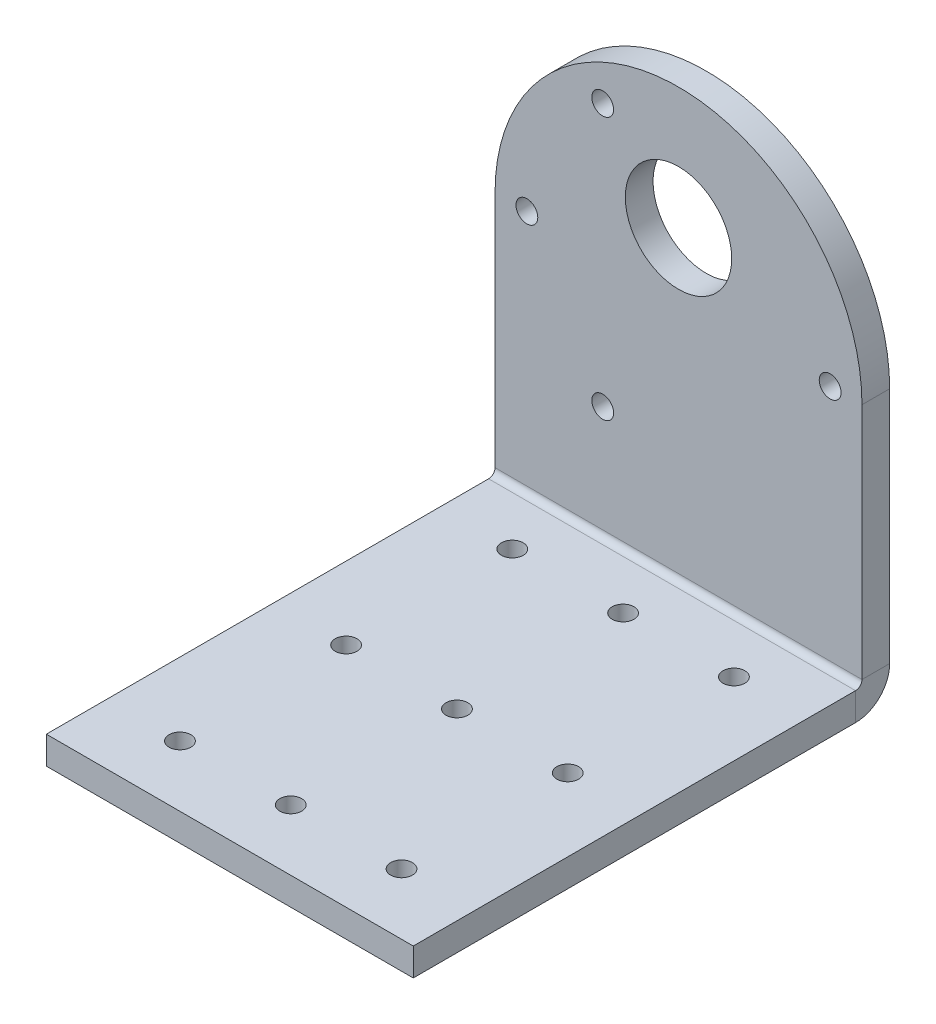
from build123d import *

# Parameters (mm, degrees)
BASE_FLANGIA1_DEPTH            = 3.175
BORDO_FLANGIA1_STRIP_W         = 14.1732
BORDO_FLANGIA1_STRIP_H         = 3.175
BORDO_FLANGIA1_STRIP_CUT_DEPTH = 42.0624
BORDO_FLANGIA1_DEPTH           = 42.0624
RIPETIZIONE_A_L1_COUNT         = 3
RIPETIZIONE_A_L1_PITCH         = 19.05
RIPETIZIONE_A_L1_COUNT_DIR2    = 3
RIPETIZIONE_A_L1_PITCH_DIR2    = 12.7
RIPETIZIONECIRCOLARE1_COUNT    = 6
SCHIZZO13_R                    = 6.096
TAGLIO_ESTRUSIONE1_DEPTH       = 10


# Sheet-metal steps are written as plain solids
with BuildPart() as part:
    # Schizzo1 → Base-Flangia1 (new body)
    with BuildSketch(Plane.XY):
        with BuildLine():
            Line((-21.0312, 0), (21.0312, 0))
            Line((21.0312, 0), (21.0312, 31.1912))
            ThreePointArc((21.0312, 31.1912), (0, 52.2224), (-21.0312, 31.1912))
            Line((-21.0312, 31.1912), (-21.0312, 0))
        make_face()
    extrude(amount=-BASE_FLANGIA1_DEPTH)

    # Bordo-Flangia1 strip (across the edge) → Bordo-Flangia1 strip cut (cut)
    with BuildSketch(Plane.YZ.offset(-21.0312)):
        with Locations((-3.175, -1.5875)):
            Rectangle(BORDO_FLANGIA1_STRIP_W, BORDO_FLANGIA1_STRIP_H)
    extrude(amount=BORDO_FLANGIA1_STRIP_CUT_DEPTH, mode=Mode.SUBTRACT)

    # Bordo-Flangia1 section (across the edge) → Bordo-Flangia1 (add)
    with BuildSketch(Plane.YZ.offset(-21.0312)):
        with BuildLine():
            Line((0, 0.7366), (0, 51.435))
            Line((0, 51.435), (3.175, 51.435))
            Line((3.175, 51.435), (3.175, 0.7366))
            ThreePointArc((3.175, 0.7366), (3.390745145, 0.215745145), (3.9116, 0))
            Line((3.9116, 0), (3.9116, -3.175))
            ThreePointArc((3.9116, -3.175), (1.145681115, -2.029318885), (0, 0.7366))
        make_face()
    extrude(amount=BORDO_FLANGIA1_DEPTH)

    # Schizzo9 → Foro filettato M3x0.5-1 (revolve, cut)
    with BuildSketch(Plane(origin=(-12.7, 3.175, 6.35), x_dir=(0, 0, 1), z_dir=(1, 0, 0))):
        Polygon((0, 0), (0, 8.251075774), (1.25, 7.5), (1.25, 0), align=None)
    foro_filettato_m3x0_5_1 = revolve(axis=Axis((-12.7, 9.525, 6.35), (0, -1, 0)), mode=Mode.SUBTRACT)

    # Ripetizione a L1: Foro filettato M3x0.5-1 3 × 3
    with Locations(*[(j * RIPETIZIONE_A_L1_PITCH_DIR2, 0, i * RIPETIZIONE_A_L1_PITCH) for i in range(RIPETIZIONE_A_L1_COUNT) for j in range(RIPETIZIONE_A_L1_COUNT_DIR2) if (i, j) != (0, 0)]):
        add(foro_filettato_m3x0_5_1, mode=Mode.SUBTRACT)

    # Schizzo11 → Foro filettato M3x0.5-2 (revolve, cut)
    with BuildSketch(Plane(origin=(-17.3812, 31.1912, -3.175), x_dir=(0, 1, 0), z_dir=(1, 0, 0))):
        Polygon((0, 0), (0, 8.251075774), (1.25, 7.5), (1.25, 0), align=None)
    foro_filettato_m3x0_5_2 = revolve(axis=Axis((-17.3812, 31.1912, -9.525), (0, 0, 1)), mode=Mode.SUBTRACT)

    # RipetizioneCircolare1: Foro filettato M3x0.5-2 ×6 about axis, 2 skipped
    ripetizionecircolare1_axis = Axis((0, 31.1912, 0), (0, 0, 1))
    add([foro_filettato_m3x0_5_2.rotate(ripetizionecircolare1_axis, i * 360 / RIPETIZIONECIRCOLARE1_COUNT) for i in range(1, RIPETIZIONECIRCOLARE1_COUNT) if i not in (2, 4)], mode=Mode.SUBTRACT)

    # Schizzo13 → Taglio-Estrusione1 (cut)
    with BuildSketch(Plane(origin=(0, 0, -3.175), x_dir=(-1, 0, 0), z_dir=(0, 0, -1))):
        with Locations((0, 38.227)):
            Circle(SCHIZZO13_R)
    extrude(amount=-TAGLIO_ESTRUSIONE1_DEPTH, mode=Mode.SUBTRACT)


solid = part.part
